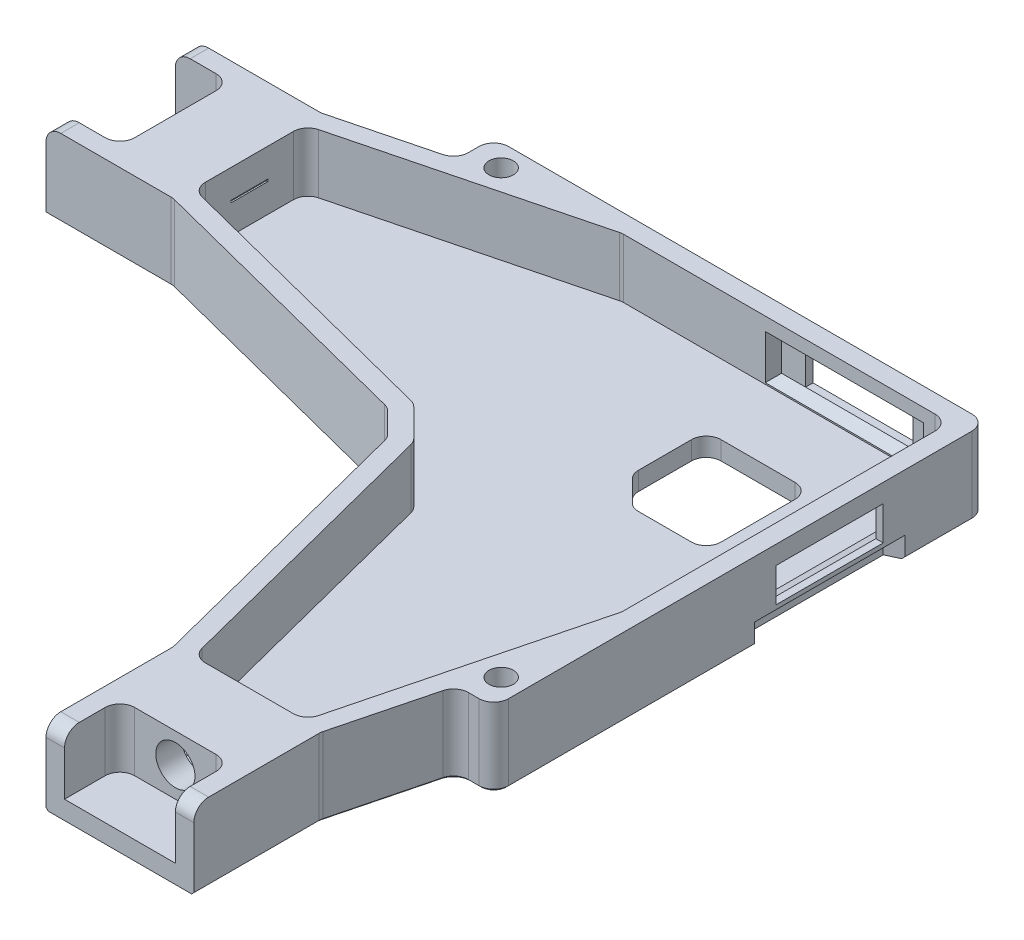
from build123d import *
from OCP.BRepFilletAPI import BRepFilletAPI_MakeChamfer

# Parameters (mm, degrees)
BOSS_EXTRUDE3_DEPTH             = 8
BOSS_EXTRUDE3_2_DEPTH           = 8
BOSS_EXTRUDE4_DEPTH             = 2.5
BOSS_EXTRUDE5_REACH             = 128.129
BOSS_EXTRUDE5_DIRECTION_2_REACH = 128.129
CUT_EXTRUDE1_REACH              = 136.554
SKETCH14_R                      = 2.65
BOSS_EXTRUDE6_REACH             = 128.129
BOSS_EXTRUDE6_DIRECTION_2_REACH = 128.129
CUT_EXTRUDE2_REACH              = 136.554
SKETCH16_R                      = 2.65
SKETCH18_W                      = 82.815220109
SKETCH18_H                      = 10.5
CUT_EXTRUDE4_DEPTH              = 1.5
SKETCH20_W                      = 81.315220109
SKETCH20_H                      = 10.5
CUT_EXTRUDE6_DEPTH              = 1.5
BOSS_EXTRUDE7_DEPTH             = 1.5
BOSS_EXTRUDE8_DEPTH             = 1.5
SKETCH17_W                      = 14.5
SKETCH17_H                      = 4.6
CUT_EXTRUDE3_DEPTH              = 139.03894378
CUT_EXTRUDE3_DIRECTION_2_REACH  = 140.039
SKETCH19_W                      = 14.5
SKETCH19_H                      = 4.6
CUT_EXTRUDE5_DEPTH              = 139.03894378
CUT_EXTRUDE5_DIRECTION_2_REACH  = 140.039
CUT_EXTRUDE7_START              = -1.5
SKETCH23_W                      = 20
SKETCH23_H                      = 4.6
CUT_EXTRUDE7_DEPTH              = 1.5
CUT_EXTRUDE9_START              = -1.5
SKETCH25_W                      = 20
SKETCH25_H                      = 4.6
CUT_EXTRUDE9_DEPTH              = 1.5
CHAMFER2_SIZE                   = 0.699461487
CHAMFER2_SIZE_2                 = 1.5
SKETCH28_W                      = 18.5
SKETCH28_H                      = 1.9
CUT_EXTRUDE10_DEPTH             = 2
SKETCH29_W                      = 18.5
SKETCH29_H                      = 1.9
CUT_EXTRUDE11_DEPTH             = 2
CHAMFER3_SIZE                   = 0.932615316
CHAMFER3_SIZE_2                 = 2
SKETCH30_W                      = 14
SKETCH30_H                      = 14
CUT_EXTRUDE12_DEPTH             = 139.117703427
FILLET1_R                       = 2
BOSS_EXTRUDE9_REACH             = 140.032
SKETCH31_W                      = 0.2
SKETCH31_H                      = 5
BOSS_EXTRUDE10_REACH            = 140.032
SKETCH32_W                      = 5
SKETCH32_H                      = 0.2
BOSS_EXTRUDE11_DEPTH            = 10.5
SKETCH35_R                      = 1.65
CUT_EXTRUDE13_DEPTH             = 139.285031728
FILLET2_R                       = 2
CHAMFER4_SIZE                   = 0.3
CHAMFER5_SIZE                   = 4
FILLET3_R                       = 2


with BuildPart() as part:
    # Sketch10 → Boss-Extrude3 (new body)
    with BuildSketch(Plane(origin=(0, -4, 0), x_dir=(1, 0, 0), z_dir=(0, 1, 0))):
        Polygon((0, 0), (-40, 0), (-80, -10.25), (-95, -10.25), (-97.5, -10.25), (-97.5, -7.75), (-80.315220109, -7.75), (-40.315220109, 2.5), (2.5, 2.5), (2.5, -40.315220109), (-7.75, -80.315220109), (-7.75, -97.5), (-10.25, -97.5), (-10.25, -95), (-10.25, -80), (0, -40), align=None)
    extrude(amount=BOSS_EXTRUDE3_DEPTH)



with BuildPart() as body_2:
    # Sketch10 → Boss-Extrude3 2 (new body)
    with BuildSketch(Plane(origin=(0, -4, 0), x_dir=(1, 0, 0), z_dir=(0, 1, 0))):
        Polygon((-95, -25.25), (-80, -25.25), (-40, -35.5), (-35.5, -40), (-25.25, -80), (-25.25, -95), (-25.25, -97.5), (-27.75, -97.5), (-27.75, -80.315220109), (-37.751824658, -41.283709248), (-41.283709248, -37.751824658), (-80.315220109, -27.75), (-97.5, -27.75), (-97.5, -25.25), align=None)
    extrude(amount=BOSS_EXTRUDE3_2_DEPTH)


with BuildPart() as part_1:
    add(part.part)

    add(body_2.part)  # Boss-Extrude4 merges body 2
    # Sketch12 → Boss-Extrude4 (add)
    with BuildSketch(Plane(origin=(0, -4, 0), x_dir=(1, 0, 0), z_dir=(0, 1, 0))):
        Polygon((-97.5, -10.25), (-97.5, -25.25), (-97.5, -27.75), (-80.315220109, -27.75), (-41.283709248, -37.751824658), (-37.751824658, -41.283709248), (-27.75, -80.315220109), (-27.75, -97.5), (-25.25, -97.5), (-10.25, -97.5), (-7.75, -97.5), (-7.75, -80.315220109), (2.5, -40.315220109), (2.5, 2.5), (-40.315220109, 2.5), (-80.315220109, -7.75), (-97.5, -7.75), align=None)
    extrude(amount=-BOSS_EXTRUDE4_DEPTH)

    # Sketch13 → Boss-Extrude5 (add, up to next)
    with BuildSketch(Plane(origin=(0, 0, 17.75), x_dir=(0, -1, 0), z_dir=(0, 0, 1)), mode=Mode.PRIVATE) as boss_extrude5_sk1:
        Polygon((-4, -80), (-0.15, -80), (-0.15, -80.2), (-3, -83.05), (-3, -86.5), (4, -86.5), (4, -90), (-4, -90), align=None)
    boss_extrude5_tool1 = extrude(boss_extrude5_sk1.sketch, amount=BOSS_EXTRUDE5_REACH, mode=Mode.PRIVATE) - part_1.part
    # Sketch13 → Boss-Extrude5 (add, up to next)
    with BuildSketch(Plane(origin=(0, 0, 17.75), x_dir=(0, -1, 0), z_dir=(0, 0, 1)), mode=Mode.PRIVATE) as boss_extrude5_sk2:
        Polygon((4, -80), (4, -84.05), (0.15, -80.2), (0.15, -80), align=None)
    boss_extrude5_tool2 = extrude(boss_extrude5_sk2.sketch, amount=BOSS_EXTRUDE5_REACH, mode=Mode.PRIVATE) - part_1.part
    add(boss_extrude5_tool1.solids().sort_by_distance((-86.56387, 0.817079, 17.75))[0])
    add(boss_extrude5_tool2.solids().sort_by_distance((-81.353137, -2.656275, 17.75))[0])

    # Sketch13 → Boss-Extrude5 direction 2 (add, up to next)
    with BuildSketch(Plane(origin=(0, 0, 17.75), x_dir=(0, -1, 0), z_dir=(0, 0, 1)), mode=Mode.PRIVATE) as boss_extrude5_direction_2_sk1:
        Polygon((-4, -80), (-0.15, -80), (-0.15, -80.2), (-3, -83.05), (-3, -86.5), (4, -86.5), (4, -90), (-4, -90), align=None)
    boss_extrude5_direction_2_tool1 = extrude(boss_extrude5_direction_2_sk1.sketch, amount=-BOSS_EXTRUDE5_DIRECTION_2_REACH, mode=Mode.PRIVATE) - part_1.part
    # Sketch13 → Boss-Extrude5 direction 2 (add, up to next)
    with BuildSketch(Plane(origin=(0, 0, 17.75), x_dir=(0, -1, 0), z_dir=(0, 0, 1)), mode=Mode.PRIVATE) as boss_extrude5_direction_2_sk2:
        Polygon((4, -80), (4, -84.05), (0.15, -80.2), (0.15, -80), align=None)
    boss_extrude5_direction_2_tool2 = extrude(boss_extrude5_direction_2_sk2.sketch, amount=-BOSS_EXTRUDE5_DIRECTION_2_REACH, mode=Mode.PRIVATE) - part_1.part
    add(boss_extrude5_direction_2_tool1.solids().sort_by_distance((-86.56387, 0.817079, 17.75))[0])
    add(boss_extrude5_direction_2_tool2.solids().sort_by_distance((-81.353137, -2.656275, 17.75))[0])

    # Sketch14 → Cut-Extrude1 (cut, up to next)
    with BuildSketch(Plane.ZY.offset(90), mode=Mode.PRIVATE) as cut_extrude1_sk1:
        with Locations((17.75, 0)):
            Circle(SKETCH14_R)
    cut_extrude1_tool1 = extrude(cut_extrude1_sk1.sketch, amount=-CUT_EXTRUDE1_REACH, mode=Mode.PRIVATE) & part_1.part
    add(cut_extrude1_tool1.solids().sort_by_distance((-90, 0, 17.75))[0], mode=Mode.SUBTRACT)

    # Sketch15 → Boss-Extrude6 (add, up to next)
    with BuildSketch(Plane(origin=(-17.75, 0, 0), x_dir=(0, -1, 0), z_dir=(1, 0, 0)), mode=Mode.PRIVATE) as boss_extrude6_sk1:
        Polygon((-0.15, -80), (-4, -80), (-4, -90), (4, -90), (4, -86.5), (-3, -86.5), (-3, -83.05), (-0.15, -80.2), align=None)
    boss_extrude6_tool1 = extrude(boss_extrude6_sk1.sketch, amount=BOSS_EXTRUDE6_REACH, mode=Mode.PRIVATE) - part_1.part
    # Sketch15 → Boss-Extrude6 (add, up to next)
    with BuildSketch(Plane(origin=(-17.75, 0, 0), x_dir=(0, -1, 0), z_dir=(1, 0, 0)), mode=Mode.PRIVATE) as boss_extrude6_sk2:
        Polygon((4, -84.05), (4, -80), (0.15, -80), (0.15, -80.2), align=None)
    boss_extrude6_tool2 = extrude(boss_extrude6_sk2.sketch, amount=BOSS_EXTRUDE6_REACH, mode=Mode.PRIVATE) - part_1.part
    add(boss_extrude6_tool1.solids().sort_by_distance((-17.75, 0.817079, 86.56387))[0])
    add(boss_extrude6_tool2.solids().sort_by_distance((-17.75, -2.656275, 81.353137))[0])

    # Sketch15 → Boss-Extrude6 direction 2 (add, up to next)
    with BuildSketch(Plane(origin=(-17.75, 0, 0), x_dir=(0, -1, 0), z_dir=(1, 0, 0)), mode=Mode.PRIVATE) as boss_extrude6_direction_2_sk1:
        Polygon((-0.15, -80), (-4, -80), (-4, -90), (4, -90), (4, -86.5), (-3, -86.5), (-3, -83.05), (-0.15, -80.2), align=None)
    boss_extrude6_direction_2_tool1 = extrude(boss_extrude6_direction_2_sk1.sketch, amount=-BOSS_EXTRUDE6_DIRECTION_2_REACH, mode=Mode.PRIVATE) - part_1.part
    # Sketch15 → Boss-Extrude6 direction 2 (add, up to next)
    with BuildSketch(Plane(origin=(-17.75, 0, 0), x_dir=(0, -1, 0), z_dir=(1, 0, 0)), mode=Mode.PRIVATE) as boss_extrude6_direction_2_sk2:
        Polygon((4, -84.05), (4, -80), (0.15, -80), (0.15, -80.2), align=None)
    boss_extrude6_direction_2_tool2 = extrude(boss_extrude6_direction_2_sk2.sketch, amount=-BOSS_EXTRUDE6_DIRECTION_2_REACH, mode=Mode.PRIVATE) - part_1.part
    add(boss_extrude6_direction_2_tool1.solids().sort_by_distance((-17.75, 0.817079, 86.56387))[0])
    add(boss_extrude6_direction_2_tool2.solids().sort_by_distance((-17.75, -2.656275, 81.353137))[0])

    # Sketch16 → Cut-Extrude2 (cut, up to next)
    with BuildSketch(Plane(origin=(0, 0, 90), x_dir=(-1, 0, 0), z_dir=(0, 0, -1)), mode=Mode.PRIVATE) as cut_extrude2_sk1:
        with Locations(Location((17.75, 0, 0), (0, 0, 180))):
            Circle(SKETCH16_R)
    cut_extrude2_tool1 = extrude(cut_extrude2_sk1.sketch, amount=CUT_EXTRUDE2_REACH, mode=Mode.PRIVATE) & part_1.part
    add(cut_extrude2_tool1.solids().sort_by_distance((-17.75, 0, 90))[0], mode=Mode.SUBTRACT)

    # Sketch18 → Cut-Extrude4 (cut)
    with BuildSketch(Plane(origin=(0, 0, -2.5), x_dir=(-1, 0, 0), z_dir=(0, 0, -1))):
        with Locations((38.907610055, -1.25)):
            Rectangle(SKETCH18_W, SKETCH18_H)
    extrude(amount=-CUT_EXTRUDE4_DEPTH, mode=Mode.SUBTRACT)

    # Sketch20 → Cut-Extrude6 (cut)
    with BuildSketch(Plane(origin=(2.5, 0, 0), x_dir=(0, 0, -1), z_dir=(1, 0, 0))):
        with Locations((-39.657610055, -1.25)):
            Rectangle(SKETCH20_W, SKETCH20_H)
    extrude(amount=-CUT_EXTRUDE6_DEPTH, mode=Mode.SUBTRACT)

    # Sketch21 → Boss-Extrude7 (add)
    with BuildSketch(Plane.XY):
        Polygon((-40, -4), (-50.07131767, -4), (-50.07131767, 4), (-40, 4), (0, 4), (0, -4), align=None)
    extrude(amount=BOSS_EXTRUDE7_DEPTH)

    # Sketch22 → Boss-Extrude8 (add)
    with BuildSketch(Plane.ZY):
        Polygon((40, -4), (50.07131767, -4), (50.07131767, 4), (40, 4), (1.5, 4), (1.5, -4), align=None)
    extrude(amount=BOSS_EXTRUDE8_DEPTH)

    # Sketch17 → Cut-Extrude3 (cut)
    with BuildSketch(Plane.XY):
        with Locations((-15.25, -0.8)):
            Rectangle(SKETCH17_W, SKETCH17_H)
    extrude(amount=-CUT_EXTRUDE3_DEPTH, mode=Mode.SUBTRACT)

    # Sketch17 → Cut-Extrude3 direction 2 (cut, up to next)
    with BuildSketch(Plane.XY, mode=Mode.PRIVATE) as cut_extrude3_direction_2_sk1:
        with Locations((-15.25, -0.8)):
            Rectangle(SKETCH17_W, SKETCH17_H)
    cut_extrude3_direction_2_tool1 = extrude(cut_extrude3_direction_2_sk1.sketch, amount=CUT_EXTRUDE3_DIRECTION_2_REACH, mode=Mode.PRIVATE) & part_1.part
    add(cut_extrude3_direction_2_tool1.solids().sort_by_distance((-15.25, -0.8, 0))[0], mode=Mode.SUBTRACT)

    # Sketch19 → Cut-Extrude5 (cut)
    with BuildSketch(Plane(origin=(0, 0, 0), x_dir=(0, 0, -1), z_dir=(1, 0, 0))):
        with Locations((-20.25, -0.8)):
            Rectangle(SKETCH19_W, SKETCH19_H)
    extrude(amount=CUT_EXTRUDE5_DEPTH, mode=Mode.SUBTRACT)

    # Sketch19 → Cut-Extrude5 direction 2 (cut, up to next)
    with BuildSketch(Plane(origin=(0, 0, 0), x_dir=(0, 0, -1), z_dir=(1, 0, 0)), mode=Mode.PRIVATE) as cut_extrude5_direction_2_sk1:
        with Locations((-20.25, -0.8)):
            Rectangle(SKETCH19_W, SKETCH19_H)
    cut_extrude5_direction_2_tool1 = extrude(cut_extrude5_direction_2_sk1.sketch, amount=-CUT_EXTRUDE5_DIRECTION_2_REACH, mode=Mode.PRIVATE) & part_1.part
    add(cut_extrude5_direction_2_tool1.solids().sort_by_distance((0, -0.8, 20.25))[0], mode=Mode.SUBTRACT)

    # Sketch23 → Cut-Extrude7 (cut)
    with BuildSketch(Plane.ZY.offset(1.5).offset(CUT_EXTRUDE7_START)):
        with Locations((20.25, -0.8)):
            Rectangle(SKETCH23_W, SKETCH23_H)
    extrude(amount=CUT_EXTRUDE7_DEPTH, mode=Mode.SUBTRACT)

    # Sketch25 → Cut-Extrude9 (cut)
    with BuildSketch(Plane(origin=(-36, 0, 1.5), x_dir=(1, 0, 0), z_dir=(0, 0, 1)).offset(CUT_EXTRUDE9_START)):
        with Locations((20.25, -0.8)):
            Rectangle(SKETCH25_W, SKETCH25_H)
    extrude(amount=CUT_EXTRUDE9_DEPTH, mode=Mode.SUBTRACT)

    # Chamfer2
    chamfer2_edges_1 = [part_1.edges().sort_by_distance(p)[0] for p in [
        (-1.5, -3.1, 20.25),
    ]]
    chamfer2_side_1 = [part_1.faces().sort_by_distance(p)[0] for p in [
        (-1.5, -3.11398923, 20.25),
    ]]
    chamfer2_edges_2 = [part_1.edges().sort_by_distance(p)[0] for p in [
        (-1.5, -0.8, 30.25),
    ]]
    chamfer2_side_2 = [part_1.faces().sort_by_distance(p)[0] for p in [
        (-1.5, -0.8, 30.26398923),
    ]]
    chamfer2_edges_3 = [part_1.edges().sort_by_distance(p)[0] for p in [
        (-1.5, 1.5, 20.25),
    ]]
    chamfer2_side_3 = [part_1.faces().sort_by_distance(p)[0] for p in [
        (-1.5, 1.51398923, 20.25),
    ]]
    chamfer2_edges_4 = [part_1.edges().sort_by_distance(p)[0] for p in [
        (-1.5, -0.8, 10.25),
    ]]
    chamfer2_side_4 = [part_1.faces().sort_by_distance(p)[0] for p in [
        (-1.5, -0.8, 10.23601077),
    ]]
    chamfer2_edges_5 = [part_1.edges().sort_by_distance(p)[0] for p in [
        (-15.75, -3.1, 1.5),
    ]]
    chamfer2_side_5 = [part_1.faces().sort_by_distance(p)[0] for p in [
        (-15.75, -3.11398923, 1.5),
    ]]
    chamfer2_edges_6 = [part_1.edges().sort_by_distance(p)[0] for p in [
        (-5.75, -0.8, 1.5),
    ]]
    chamfer2_side_6 = [part_1.faces().sort_by_distance(p)[0] for p in [
        (-5.73601077, -0.8, 1.5),
    ]]
    chamfer2_edges_7 = [part_1.edges().sort_by_distance(p)[0] for p in [
        (-15.75, 1.5, 1.5),
    ]]
    chamfer2_side_7 = [part_1.faces().sort_by_distance(p)[0] for p in [
        (-15.75, 1.51398923, 1.5),
    ]]
    chamfer2_edges_8 = [part_1.edges().sort_by_distance(p)[0] for p in [
        (-25.75, -0.8, 1.5),
    ]]
    chamfer2_side_8 = [part_1.faces().sort_by_distance(p)[0] for p in [
        (-25.76398923, -0.8, 1.5),
    ]]
    chamfer2 = BRepFilletAPI_MakeChamfer(part_1.part.solid().wrapped)
    for e in chamfer2_edges_1:
        chamfer2.Add(CHAMFER2_SIZE - 0.0001, CHAMFER2_SIZE_2 - 0.0001, e.wrapped, chamfer2_side_1[0].wrapped)
    for e in chamfer2_edges_2:
        chamfer2.Add(CHAMFER2_SIZE - 0.0001, CHAMFER2_SIZE_2 - 0.0001, e.wrapped, chamfer2_side_2[0].wrapped)
    for e in chamfer2_edges_3:
        chamfer2.Add(CHAMFER2_SIZE - 0.0001, CHAMFER2_SIZE_2 - 0.0001, e.wrapped, chamfer2_side_3[0].wrapped)
    for e in chamfer2_edges_4:
        chamfer2.Add(CHAMFER2_SIZE - 0.0001, CHAMFER2_SIZE_2 - 0.0001, e.wrapped, chamfer2_side_4[0].wrapped)
    for e in chamfer2_edges_5:
        chamfer2.Add(CHAMFER2_SIZE - 0.0001, CHAMFER2_SIZE_2 - 0.0001, e.wrapped, chamfer2_side_5[0].wrapped)
    for e in chamfer2_edges_6:
        chamfer2.Add(CHAMFER2_SIZE - 0.0001, CHAMFER2_SIZE_2 - 0.0001, e.wrapped, chamfer2_side_6[0].wrapped)
    for e in chamfer2_edges_7:
        chamfer2.Add(CHAMFER2_SIZE - 0.0001, CHAMFER2_SIZE_2 - 0.0001, e.wrapped, chamfer2_side_7[0].wrapped)
    for e in chamfer2_edges_8:
        chamfer2.Add(CHAMFER2_SIZE - 0.0001, CHAMFER2_SIZE_2 - 0.0001, e.wrapped, chamfer2_side_8[0].wrapped)
    add(Compound.cast(chamfer2.Shape()), mode=Mode.REPLACE)  # a hair under: the kernel refuses the full size

    # Sketch28 → Cut-Extrude10 (cut)
    with BuildSketch(Plane(origin=(0, 0, -1), x_dir=(-1, 0, 0), z_dir=(0, 0, -1))):
        with Locations((15.25, -5.55)):
            Rectangle(SKETCH28_W, SKETCH28_H)
    extrude(amount=-CUT_EXTRUDE10_DEPTH, mode=Mode.SUBTRACT)

    # Sketch29 → Cut-Extrude11 (cut)
    with BuildSketch(Plane(origin=(1, 0, 5), x_dir=(0, 0, 1), z_dir=(-1, 0, 0))):
        with Locations((15.25, -5.55)):
            Rectangle(SKETCH29_W, SKETCH29_H)
    extrude(amount=CUT_EXTRUDE11_DEPTH, mode=Mode.SUBTRACT)

    # Chamfer3
    chamfer3_edges_1 = [part_1.edges().sort_by_distance(p)[0] for p in [
        (-24.5, -5.55, -1),
    ]]
    chamfer3_side_1 = [part_1.faces().sort_by_distance(p)[0] for p in [
        (-24.518652306, -5.55, -1),
    ]]
    chamfer3_edges_2 = [part_1.edges().sort_by_distance(p)[0] for p in [
        (-15.25, -4.6, -1),
    ]]
    chamfer3_side_2 = [part_1.faces().sort_by_distance(p)[0] for p in [
        (-15.25, -4.581347694, -1),
    ]]
    chamfer3_edges_3 = [part_1.edges().sort_by_distance(p)[0] for p in [
        (-6, -5.55, -1),
    ]]
    chamfer3_side_3 = [part_1.faces().sort_by_distance(p)[0] for p in [
        (-5.981347694, -5.55, -1),
    ]]
    chamfer3_edges_4 = [part_1.edges().sort_by_distance(p)[0] for p in [
        (1, -5.55, 11),
    ]]
    chamfer3_side_4 = [part_1.faces().sort_by_distance(p)[0] for p in [
        (1, -5.55, 10.981347694),
    ]]
    chamfer3_edges_5 = [part_1.edges().sort_by_distance(p)[0] for p in [
        (1, -5.55, 29.5),
    ]]
    chamfer3_side_5 = [part_1.faces().sort_by_distance(p)[0] for p in [
        (1, -5.55, 29.518652306),
    ]]
    chamfer3_edges_6 = [part_1.edges().sort_by_distance(p)[0] for p in [
        (1, -4.6, 20.25),
    ]]
    chamfer3_side_6 = [part_1.faces().sort_by_distance(p)[0] for p in [
        (1, -4.581347694, 20.25),
    ]]
    chamfer3 = BRepFilletAPI_MakeChamfer(part_1.part.solid().wrapped)
    for e in chamfer3_edges_1:
        chamfer3.Add(CHAMFER3_SIZE - 0.0001, CHAMFER3_SIZE_2 - 0.0001, e.wrapped, chamfer3_side_1[0].wrapped)
    for e in chamfer3_edges_2:
        chamfer3.Add(CHAMFER3_SIZE - 0.0001, CHAMFER3_SIZE_2 - 0.0001, e.wrapped, chamfer3_side_2[0].wrapped)
    for e in chamfer3_edges_3:
        chamfer3.Add(CHAMFER3_SIZE - 0.0001, CHAMFER3_SIZE_2 - 0.0001, e.wrapped, chamfer3_side_3[0].wrapped)
    for e in chamfer3_edges_4:
        chamfer3.Add(CHAMFER3_SIZE - 0.0001, CHAMFER3_SIZE_2 - 0.0001, e.wrapped, chamfer3_side_4[0].wrapped)
    for e in chamfer3_edges_5:
        chamfer3.Add(CHAMFER3_SIZE - 0.0001, CHAMFER3_SIZE_2 - 0.0001, e.wrapped, chamfer3_side_5[0].wrapped)
    for e in chamfer3_edges_6:
        chamfer3.Add(CHAMFER3_SIZE - 0.0001, CHAMFER3_SIZE_2 - 0.0001, e.wrapped, chamfer3_side_6[0].wrapped)
    add(Compound.cast(chamfer3.Shape()), mode=Mode.REPLACE)  # a hair under: the kernel refuses the full size

    # Sketch30 → Cut-Extrude12 (cut, through all)
    with BuildSketch(Plane(origin=(0, -4, 0), x_dir=(1, 0, 0), z_dir=(0, 1, 0))):
        with Locations((-17.968684618, -17.968684618)):
            Rectangle(SKETCH30_W, SKETCH30_H)
    extrude(amount=-CUT_EXTRUDE12_DEPTH, mode=Mode.SUBTRACT)

    # Fillet1
    fillet1_edges = [part_1.edges().sort_by_distance(p)[0] for p in [
        (-24.968684618, -5.25, 10.968684618),
        (-10.968684618, -5.25, 10.968684618),
        (-10.968684618, -5.25, 24.968684618),
    ]]
    fillet(fillet1_edges, radius=FILLET1_R)

    # Sketch31 → Boss-Extrude9 (add, up to next)
    with BuildSketch(Plane(origin=(0, -0.15, 0), x_dir=(1, 0, 0), z_dir=(0, 1, 0)), mode=Mode.PRIVATE) as boss_extrude9_sk1:
        with Locations((-80.1, -12.75)):
            Rectangle(SKETCH31_W, SKETCH31_H)
    boss_extrude9_tool1 = extrude(boss_extrude9_sk1.sketch, amount=BOSS_EXTRUDE9_REACH, mode=Mode.PRIVATE) - part_1.part
    # Sketch31 → Boss-Extrude9 (add, up to next)
    with BuildSketch(Plane(origin=(0, -0.15, 0), x_dir=(1, 0, 0), z_dir=(0, 1, 0)), mode=Mode.PRIVATE) as boss_extrude9_sk2:
        with Locations((-80.1, -22.75)):
            Rectangle(SKETCH31_W, SKETCH31_H)
    boss_extrude9_tool2 = extrude(boss_extrude9_sk2.sketch, amount=BOSS_EXTRUDE9_REACH, mode=Mode.PRIVATE) - part_1.part
    add(boss_extrude9_tool1.solids().sort_by_distance((-80.1, -0.15, 12.75))[0])
    add(boss_extrude9_tool2.solids().sort_by_distance((-80.1, -0.15, 22.75))[0])

    # Sketch32 → Boss-Extrude10 (add, up to next)
    with BuildSketch(Plane(origin=(0, -0.15, 0), x_dir=(1, 0, 0), z_dir=(0, 1, 0)), mode=Mode.PRIVATE) as boss_extrude10_sk1:
        with Locations((-22.75, -80.1)):
            Rectangle(SKETCH32_W, SKETCH32_H)
    boss_extrude10_tool1 = extrude(boss_extrude10_sk1.sketch, amount=BOSS_EXTRUDE10_REACH, mode=Mode.PRIVATE) - part_1.part
    # Sketch32 → Boss-Extrude10 (add, up to next)
    with BuildSketch(Plane(origin=(0, -0.15, 0), x_dir=(1, 0, 0), z_dir=(0, 1, 0)), mode=Mode.PRIVATE) as boss_extrude10_sk2:
        with Locations((-12.75, -80.1)):
            Rectangle(SKETCH32_W, SKETCH32_H)
    boss_extrude10_tool2 = extrude(boss_extrude10_sk2.sketch, amount=BOSS_EXTRUDE10_REACH, mode=Mode.PRIVATE) - part_1.part
    add(boss_extrude10_tool1.solids().sort_by_distance((-22.75, -0.15, 80.1))[0])
    add(boss_extrude10_tool2.solids().sort_by_distance((-12.75, -0.15, 80.1))[0])

    # Sketch33 → Boss-Extrude11 (add)
    with BuildSketch(Plane.XZ.offset(6.5)):
        Polygon((-46.168878646, -1), (-65.681073768, -1), (-65.681073768, 4), align=None)
        Polygon((1, 65.681073768), (-4, 65.681073768), (1, 46.168878646), align=None)
    extrude(amount=-BOSS_EXTRUDE11_DEPTH)

    # Sketch35 → Cut-Extrude13 (cut, through all)
    with BuildSketch(Plane(origin=(0, 4, 0), x_dir=(1, 0, 0), z_dir=(0, 1, 0))):
        with Locations(Location((-61.681073768, -2, 0), (0, 0, 270))):
            Circle(SKETCH35_R)
        with Locations(Location((-2, -61.681073768, 0), (0, 0, 90))):
            Circle(SKETCH35_R)
    extrude(amount=-CUT_EXTRUDE13_DEPTH, mode=Mode.SUBTRACT)

    # Fillet2
    fillet2_edges = [part_1.edges().sort_by_distance(p)[0] for p in [
        (-90, 0, 10.25),
        (-90, 0, 25.25),
        (-25.25, 0, 90),
        (-10.25, 0, 90),
        (-97.5, 4, 9),
        (-97.5, 4, 26.5),
        (-80.315220109, -1.25, 7.75),
        (1, -1.25, -1),
        (-7.75, -1.25, 80.315220109),
        (-27.75, -1.25, 80.315220109),
        (-37.751824658, -1.25, 41.283709248),
        (-41.283709248, -1.25, 37.751824658),
        (-80.315220109, -1.25, 27.75),
        (-40, 0, 35.5),
        (-1.5, 0, 45.853658537),
        (-35.5, 0, 40),
        (-1.5, 0, 1.5),
        (-45.853658537, 0, 1.5),
        (-80, 0, 10.25),
        (-80, 0, 25.25),
        (-10.25, 0, 80),
        (-25.25, 0, 80),
        (-65.681073768, -1.25, -1),
        (-65.681073768, -1.25, 4),
        (1, -1.25, 65.681073768),
        (-4, -1.25, 65.681073768),
        (-9, 4, 97.5),
        (-26.5, 4, 97.5),
    ]]
    fillet(fillet2_edges, radius=FILLET2_R)

    # Chamfer4
    chamfer4_edges = [part_1.edges().sort_by_distance(p)[0] for p in [
        (-7.75, -6.5, 89.033698099),
        (-89.033698099, -6.5, 27.75),
        (-44.556794542, -6.5, -1),
        (1, -6.5, 5.533742342),
        (-27.75, -6.5, 89.033698099),
        (-65.681073768, -6.5, 1.723939939),
        (-3.033742342, -6.5, -1),
        (1, -6.5, 47.056794542),
        (-1.723939939, -6.5, 65.681073768),
        (-6.036342348, -6.5, 73.627775615),
        (-32.714239783, -6.5, 60.942577054),
        (-39.517766953, -6.5, 39.517766953),
        (-60.942577054, -6.5, 32.714239783),
        (-89.033698099, -6.5, 7.75),
        (-73.627775615, -6.5, 6.036342348),
        (0.414213562, -6.5, -0.414213562),
        (0.414213562, -6.5, 65.09528733),
        (-65.09528733, -6.5, -0.414213562),
        (-66.101054981, -6.5, 3.674069354),
        (-3.674069354, -6.5, 66.101054981),
        (-80.317201092, -6.5, 7.734288893),
        (-7.734288893, -6.5, 80.317201092),
        (-27.765711107, -6.5, 80.317201092),
        (-37.815786012, -6.5, 41.320172025),
        (-41.320172025, -6.5, 37.815786012),
        (-80.317201092, -6.5, 27.765711107),
    ]]
    chamfer(chamfer4_edges, length=CHAMFER4_SIZE)

    # Chamfer5
    chamfer5_edges = [part_1.edges().sort_by_distance(p)[0] for p in [
        (-24.968684618, -5.25, 24.968684618),
    ]]
    chamfer(chamfer5_edges, length=CHAMFER5_SIZE)

    # Fillet3
    fillet3_edges = [part_1.edges().sort_by_distance(p)[0] for p in [
        (-20.968684618, -5.25, 24.968684618),
        (-24.968684618, -5.25, 20.968684618),
    ]]
    fillet(fillet3_edges, radius=FILLET3_R)


solid = part_1.part
